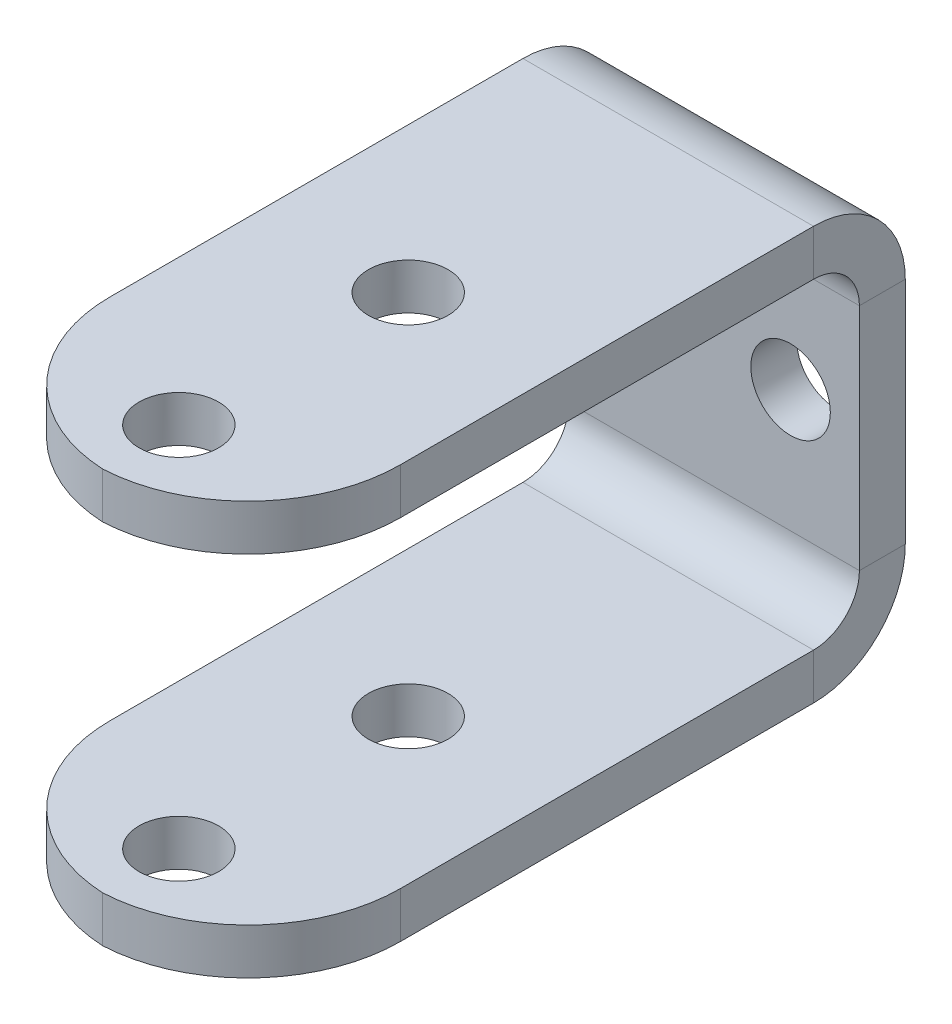
from build123d import *

# Parameters (mm, degrees)
SKETCH1_W                      = 19
SKETCH1_H                      = 27
BASE_FLANGE1_DEPTH             = 3
EDGE_FLANGE1_STRIP_W           = 18
EDGE_FLANGE1_STRIP_H           = 3
EDGE_FLANGE1_STRIP_CUT_DEPTH   = 19
EDGE_FLANGE1_STRIP_2_W         = 18
EDGE_FLANGE1_STRIP_2_H         = 3
EDGE_FLANGE1_STRIP_CUT_2_DEPTH = 19
EDGE_FLANGE1_DEPTH             = 19
EDGE_FLANGE1_BEND_DEPTH        = 19
SKETCH12_R                     = 2.6
CUT_EXTRUDE1_DEPTH             = 10
SKETCH13_R                     = 2.6
CUT_EXTRUDE2_DEPTH             = 50.185871955
FILLET1_R                      = 10


# Sheet-metal steps are written as plain solids
with BuildPart() as part:
    # Sketch1 → Base-Flange1 (new body)
    with BuildSketch(Plane.XY):
        Rectangle(SKETCH1_W, SKETCH1_H)
    extrude(amount=-BASE_FLANGE1_DEPTH)

    # Edge-Flange1 strip (across the edge) → Edge-Flange1 strip cut (cut)
    with BuildSketch(Plane(origin=(9.5, 13.5, 0), x_dir=(0, -1, 0), z_dir=(-1, 0, 0))):
        with Locations((-3, -1.5)):
            Rectangle(EDGE_FLANGE1_STRIP_W, EDGE_FLANGE1_STRIP_H)
    extrude(amount=EDGE_FLANGE1_STRIP_CUT_DEPTH, mode=Mode.SUBTRACT)

    # Edge-Flange1 strip 2 (across the edge) → Edge-Flange1 strip cut 2 (cut)
    with BuildSketch(Plane(origin=(-9.5, -13.5, 0), x_dir=(0, 1, 0), z_dir=(1, 0, 0))):
        with Locations((-3, -1.5)):
            Rectangle(EDGE_FLANGE1_STRIP_2_W, EDGE_FLANGE1_STRIP_2_H)
    extrude(amount=EDGE_FLANGE1_STRIP_CUT_2_DEPTH, mode=Mode.SUBTRACT)

    # Edge-Flange1 section (across the edge) → Edge-Flange1 (add)
    with BuildSketch(Plane(origin=(9.5, 13.5, 0), x_dir=(0, -1, 0), z_dir=(-1, 0, 0))):
        with BuildLine():
            Line((0, 3), (0, 40))
            Line((0, 40), (3, 40))
            Line((3, 40), (3, 3))
            ThreePointArc((3, 3), (3.878679656, 0.878679656), (6, 0))
            Line((6, 0), (6, -3))
            ThreePointArc((6, -3), (1.757359313, -1.242640687), (0, 3))
        make_face()
    extrude(amount=EDGE_FLANGE1_DEPTH)

    # Edge-Flange1 section 2 (across the edge) → Edge-Flange1 bend (add)
    with BuildSketch(Plane(origin=(-9.5, -13.5, 0), x_dir=(0, 1, 0), z_dir=(1, 0, 0))):
        with BuildLine():
            Line((0, 3), (0, 40))
            Line((0, 40), (3, 40))
            Line((3, 40), (3, 3))
            ThreePointArc((3, 3), (3.878679656, 0.878679656), (6, 0))
            Line((6, 0), (6, -3))
            ThreePointArc((6, -3), (1.757359313, -1.242640687), (0, 3))
        make_face()
    extrude(amount=EDGE_FLANGE1_BEND_DEPTH)

    # Sketch12 → Cut-Extrude1 (cut)
    with BuildSketch(Plane.XY):
        with Locations((5, 0.5)):
            Circle(SKETCH12_R)
        with Locations((-5, 0.5)):
            Circle(SKETCH12_R)
    extrude(amount=-CUT_EXTRUDE1_DEPTH, mode=Mode.SUBTRACT)

    # Sketch13 → Cut-Extrude2 (cut, through all)
    with BuildSketch(Plane(origin=(0, 13.5, 0), x_dir=(1, 0, 0), z_dir=(0, 1, 0))):
        with Locations(Location((0, -35, 0), (0, 0, 270))):
            Circle(SKETCH13_R)
        with Locations(Location((0, -20, 0), (0, 0, 270))):
            Circle(SKETCH13_R)
    extrude(amount=-CUT_EXTRUDE2_DEPTH, mode=Mode.SUBTRACT)

    # Fillet1
    # the kernel refuses this fillet: 10 mm, written as the material it takes off along each edge
    with BuildSketch(Plane(origin=(-9.5, -38.5, 40), x_dir=(0, 0, -1), z_dir=(0, 1, 0)), Plane(origin=(9.5, -38.5, 40), x_dir=(-1, 0, 0), z_dir=(0, 1, 0))) as fillet1_piece_1:
        with BuildLine():
            CenterArc((FILLET1_R, -FILLET1_R), FILLET1_R, 90, 90)
            Line((0, -FILLET1_R), (0, 0))
            Line((0, 0), (FILLET1_R, 0))
        make_face()
    extrude(amount=53, mode=Mode.SUBTRACT)
    with BuildSketch(Plane(origin=(-9.5, 38.5, 40), x_dir=(0, 0, -1), z_dir=(0, -1, 0)), Plane(origin=(9.5, 38.5, 40), x_dir=(-1, 0, 0), z_dir=(0, -1, 0))) as fillet1_piece_2:
        with BuildLine():
            CenterArc((FILLET1_R, FILLET1_R), FILLET1_R, 180, 90)
            Line((0, FILLET1_R), (0, 0))
            Line((0, 0), (FILLET1_R, 0))
        make_face()
    extrude(amount=53, mode=Mode.SUBTRACT)


solid = part.part
